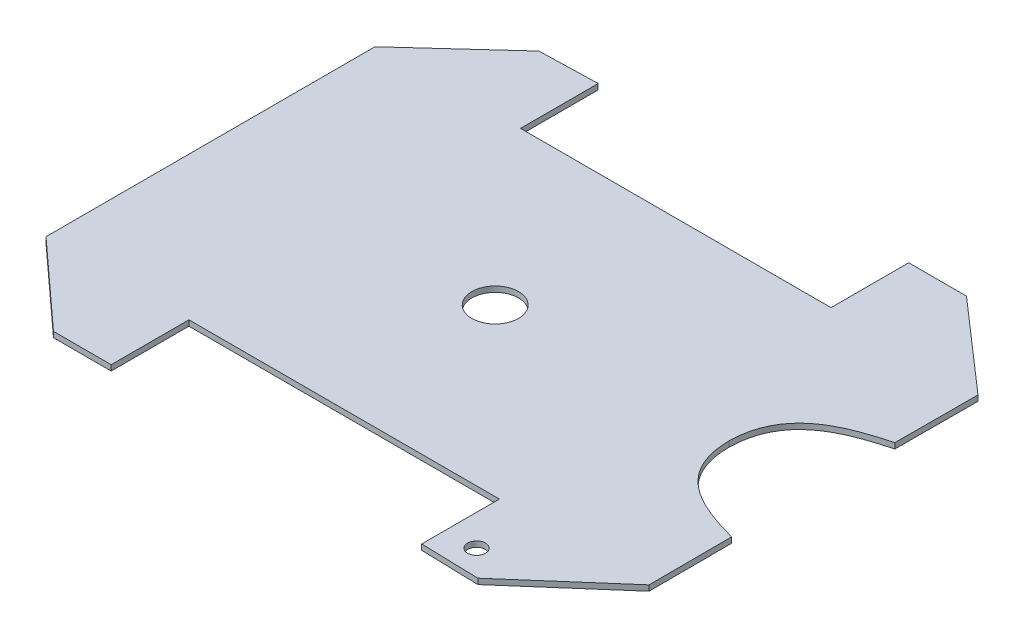
from build123d import *

# Parameters (mm, degrees)
EXTRUDE_1_DEPTH     = 5
SKETCH_2_R          = 21
CUT_EXTRUDE_1_DEPTH = 403.120979525
SKETCH1_R           = 8
CUT_EXTRUDE1_DEPTH  = 403.120979525


with BuildPart() as part:
    # Эскиз1 → Вытянуть1 (new body)
    with BuildSketch(Plane(origin=(0, 0, 0), x_dir=(1, 0, 0), z_dir=(0, 1, 0))):
        with BuildLine():
            Line((-269.7921816, 73.262575573), (-269.7921816, -223.012011978))
            Line((-269.7921816, -223.012011978), (-192.586469874, -293.492830448))
            Line((-192.586469874, -293.492830448), (-140.586469874, -293.492830448))
            Line((-140.586469874, -293.492830448), (-140.586469874, -223.492830448))
            Line((-140.586469874, -223.492830448), (139.068300868, -223.492830448))
            Line((139.068300868, -223.492830448), (139.068300868, -293.492830448))
            Line((139.068300868, -293.492830448), (191.068300868, -294.890935713))
            Line((191.068300868, -294.890935713), (273.341577689, -223.012011978))
            Line((273.341577689, -223.012011978), (273.101729514, -148.382005757))
            add(Edge.make_bspline(
                [(273.101729514, -148.382005757), (239.363891717, -139.145872689), (197.437007815, -125.423723423), (197.047353036, -74.874718203)],
                knots=[0, 0, 0, 0, 1, 1, 1, 1], degree=3))
            add(Edge.make_bspline(
                [(273.101729514, -1.367430648), (239.363891717, -10.603563716), (197.437007815, -24.325712982), (197.047353036, -74.874718203)],
                knots=[0, 0, 0, 0, 1, 1, 1, 1], degree=3))
            Line((273.101729514, -1.367430648), (273.341577689, 73.262575573))
            Line((273.341577689, 73.262575573), (191.068300868, 145.141499308))
            Line((191.068300868, 145.141499308), (139.068300868, 145.141499308))
            Line((139.068300868, 145.141499308), (139.068300868, 75.141499308))
            Line((139.068300868, 75.141499308), (-140.586469874, 75.141499308))
            Line((-140.586469874, 75.141499308), (-140.586469874, 145.141499308))
            Line((-140.586469874, 145.141499308), (-192.586469874, 143.743394043))
            Line((-192.586469874, 143.743394043), (-269.7921816, 73.262575573))
        make_face()
    extrude(amount=EXTRUDE_1_DEPTH)

    # Эскиз2 → Вырез-Вытянуть1 (cut, through all)
    with BuildSketch(Plane(origin=(0, 5, 0), x_dir=(-1, 0, 0), z_dir=(0, 1, 0))):
        with Locations((14.229950912, 74.026657254)):
            Circle(SKETCH_2_R)
    extrude(amount=-CUT_EXTRUDE_1_DEPTH, mode=Mode.SUBTRACT)

    # Sketch1 → Cut-Extrude1 (cut, through all)
    with BuildSketch(Plane(origin=(0, 5, 0), x_dir=(1, 0, 0), z_dir=(0, 1, 0))):
        with Locations((167.052967516, -272.065876514)):
            Circle(SKETCH1_R)
    extrude(amount=-CUT_EXTRUDE1_DEPTH, mode=Mode.SUBTRACT)


solid = part.part
